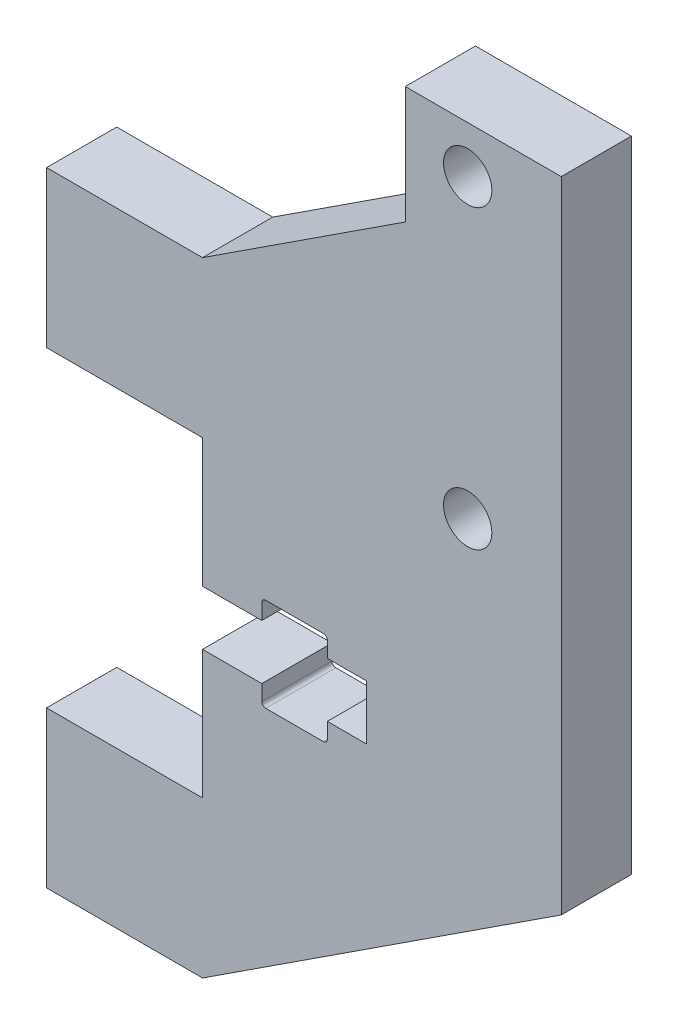
from build123d import *

# Parameters (mm, degrees)
BOSS_EXTRUDE1_DEPTH = 4.5
SCREW_CUTOUT_DEPTH  = 51.737067318
SKETCH3_R           = 1.55
CUT_EXTRUDE2_DEPTH  = 51.737067318


with BuildPart() as part:
    # Sketch1 → Boss-Extrude1 (new body)
    with BuildSketch(Plane.XY):
        Polygon((13, 3.47826087), (0, -5), (-10, -5), (-10, -15), (0, -15), (0, -35), (-10, -35), (-10, -45), (0, -45), (23, -30), (23, 11), (13, 11), align=None)
    extrude(amount=BOSS_EXTRUDE1_DEPTH)

    # Sketch2 → screw-cutout (cut, through all)
    with BuildSketch(Plane.XY.offset(4.5)):
        with BuildLine():
            Line((0, -26.75), (0, -23.25))
            Line((0, -23.25), (3.8, -23.25))
            Line((3.8, -23.25), (3.8, -22.25))
            ThreePointArc((3.8, -22.25), (3.873223305, -22.073223305), (4.05, -22))
            Line((4.05, -22), (7.75, -22))
            ThreePointArc((7.75, -22), (7.926776695, -22.073223305), (8, -22.25))
            Line((8, -22.25), (8, -23.25))
            Line((8, -23.25), (10.5, -23.25))
            Line((10.5, -23.25), (10.5, -26.75))
            Line((10.5, -26.75), (8, -26.75))
            Line((8, -26.75), (8, -27.75))
            ThreePointArc((8, -27.75), (7.926776695, -27.926776695), (7.75, -28))
            Line((7.75, -28), (4.05, -28))
            ThreePointArc((4.05, -28), (3.873223305, -27.926776695), (3.8, -27.75))
            Line((3.8, -27.75), (3.8, -26.75))
            Line((3.8, -26.75), (0, -26.75))
        make_face()
    extrude(amount=-SCREW_CUTOUT_DEPTH, mode=Mode.SUBTRACT)

    # Sketch3 → Cut-Extrude2 (cut, through all)
    with BuildSketch(Plane.XY.offset(4.5)):
        with Locations((17, 8)):
            Circle(SKETCH3_R)
        with Locations((17, -11)):
            Circle(SKETCH3_R)
    extrude(amount=-CUT_EXTRUDE2_DEPTH, mode=Mode.SUBTRACT)


solid = part.part
